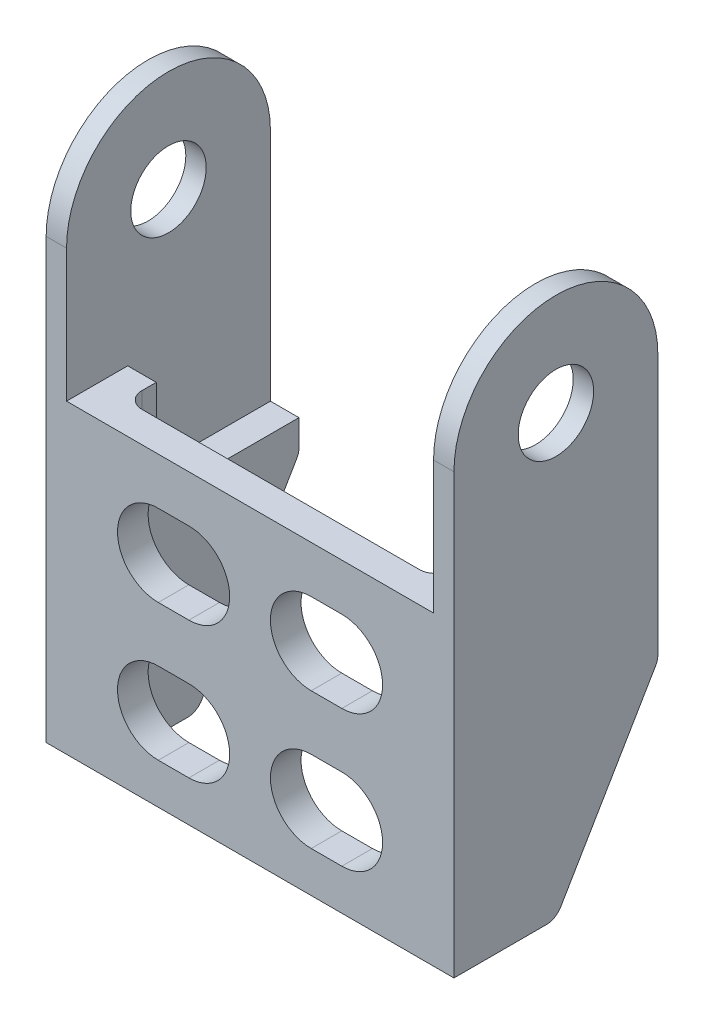
from build123d import *

# Parameters (mm, degrees)
SKETCH1_W           = 20
SKETCH1_H           = 15
BOSS_EXTRUDE1_DEPTH = 1.5
SKETCH2_R           = 1.85
BOSS_EXTRUDE2_DEPTH = 2.4
CUT_EXTRUDE1_DEPTH  = 1.4
MIRROR1_START       = -10
MIRROR1_OUTLINE_R   = 1.85
MIRROR1_DEPTH       = 1
MIRROR1_START_2     = -9
MIRROR1_2_DEPTH     = 1.4
FILLET1_R           = 0.8
CUT_EXTRUDE2_DEPTH  = 1.5


# Read off the part's stored shape, not the designer's step: Mirror1
with BuildPart() as part:
    # Sketch1 → Boss-Extrude1 (new body)
    with BuildSketch(Plane.XY):
        Rectangle(SKETCH1_W, SKETCH1_H)
    extrude(amount=BOSS_EXTRUDE1_DEPTH)

    # Sketch2 → Boss-Extrude2 (add)
    with BuildSketch(Plane(origin=(10, 0, 0), x_dir=(0, 0, -1), z_dir=(1, 0, 0))):
        with BuildLine():
            Line((0, 7.5), (0, -7.5))
            Line((0, -7.5), (3.5, -7.5))
            Line((3.5, -7.5), (8.5, 1))
            Line((8.5, 1), (8.5, 14))
            ThreePointArc((8.5, 14), (3.5, 19), (-1.5, 14))
            Line((-1.5, 14), (-1.5, 7.5))
            Line((-1.5, 7.5), (0, 7.5))
        make_face()
        with Locations((3.5, 14)):
            Circle(SKETCH2_R, mode=Mode.SUBTRACT)
    extrude(amount=-BOSS_EXTRUDE2_DEPTH)

    # Sketch3 → Cut-Extrude1 (cut)
    with BuildSketch(Plane.ZY.offset(-7.6)):
        with BuildLine():
            Line((1.5, 7.5), (-1.5, 7.5))
            Line((-1.5, 7.5), (-1.5, 5.5))
            ThreePointArc((-1.5, 5.5), (-2.378679656, 3.378679656), (-4.5, 2.5))
            Line((-4.5, 2.5), (-8.5, 2.5))
            Line((-8.5, 2.5), (-8.5, 19.043681707))
            Line((-8.5, 19.043681707), (1.5, 19.043681707))
            Line((1.5, 19.043681707), (1.5, 7.5))
        make_face()
    extrude(amount=-CUT_EXTRUDE1_DEPTH, mode=Mode.SUBTRACT)

    # Mirror1 outline → Mirror1 (add)
    with BuildSketch(Plane.YZ.offset(MIRROR1_START)):
        with BuildLine():
            ThreePointArc((14, -8.5), (19, -3.5), (14, 1.5))
            Line((14, 1.5), (7.5, 1.5))
            Line((7.5, 1.5), (7.5, 0))
            Line((7.5, 0), (-7.5, 0))
            Line((-7.5, 0), (-7.5, -3.5))
            Line((-7.5, -3.5), (1, -8.5))
            Line((1, -8.5), (14, -8.5))
        make_face()
        with Locations((14, -3.5)):
            Circle(MIRROR1_OUTLINE_R, mode=Mode.SUBTRACT)
    extrude(amount=MIRROR1_DEPTH)

    # Mirror1 2 outline → Mirror1 2 (add)
    with BuildSketch(Plane.YZ.offset(MIRROR1_START_2)):
        with BuildLine():
            Line((1, -8.5), (2.5, -8.5))
            Line((2.5, -8.5), (2.5, -4.5))
            ThreePointArc((2.5, -4.5), (3.378679656, -2.378679656), (5.5, -1.5))
            Line((5.5, -1.5), (7.5, -1.5))
            Line((7.5, -1.5), (7.5, 0))
            Line((7.5, 0), (-7.5, 0))
            Line((-7.5, 0), (-7.5, -3.5))
            Line((-7.5, -3.5), (1, -8.5))
        make_face()
    extrude(amount=MIRROR1_2_DEPTH)

    # Fillet1
    fillet1_edges = [part.edges().sort_by_distance(p)[0] for p in [
        (8.8, 1, -8.5),
        (8.8, -7.5, -3.5),
        (7.6, 0, 0),
        (-8.8, 1, -8.5),
        (-7.6, 0, 0),
        (-8.8, -7.5, -3.5),
    ]]
    fillet(fillet1_edges, radius=FILLET1_R)

    # Sketch4 → Cut-Extrude2 (cut)
    with BuildSketch(Plane.XY.offset(1.5)):
        with BuildLine():
            Line((-4.5, 5.2), (-3, 5.2))
            ThreePointArc((-3, 5.2), (-1, 3.2), (-3, 1.2))
            Line((-3, 1.2), (-4.5, 1.2))
            ThreePointArc((-4.5, 1.2), (-6.5, 3.2), (-4.5, 5.2))
        make_face()
        with BuildLine():
            Line((3, 5.2), (4.5, 5.2))
            ThreePointArc((4.5, 5.2), (6.5, 3.2), (4.5, 1.2))
            Line((4.5, 1.2), (3, 1.2))
            ThreePointArc((3, 1.2), (1, 3.2), (3, 5.2))
        make_face()
        with BuildLine():
            Line((-4.5, -1.5), (-3, -1.5))
            ThreePointArc((-3, -1.5), (-1, -3.5), (-3, -5.5))
            Line((-3, -5.5), (-4.5, -5.5))
            ThreePointArc((-4.5, -5.5), (-6.5, -3.5), (-4.5, -1.5))
        make_face()
        with BuildLine():
            Line((3, -1.5), (4.5, -1.5))
            ThreePointArc((4.5, -1.5), (6.5, -3.5), (4.5, -5.5))
            Line((4.5, -5.5), (3, -5.5))
            ThreePointArc((3, -5.5), (1, -3.5), (3, -1.5))
        make_face()
    extrude(amount=-CUT_EXTRUDE2_DEPTH, mode=Mode.SUBTRACT)


solid = part.part
